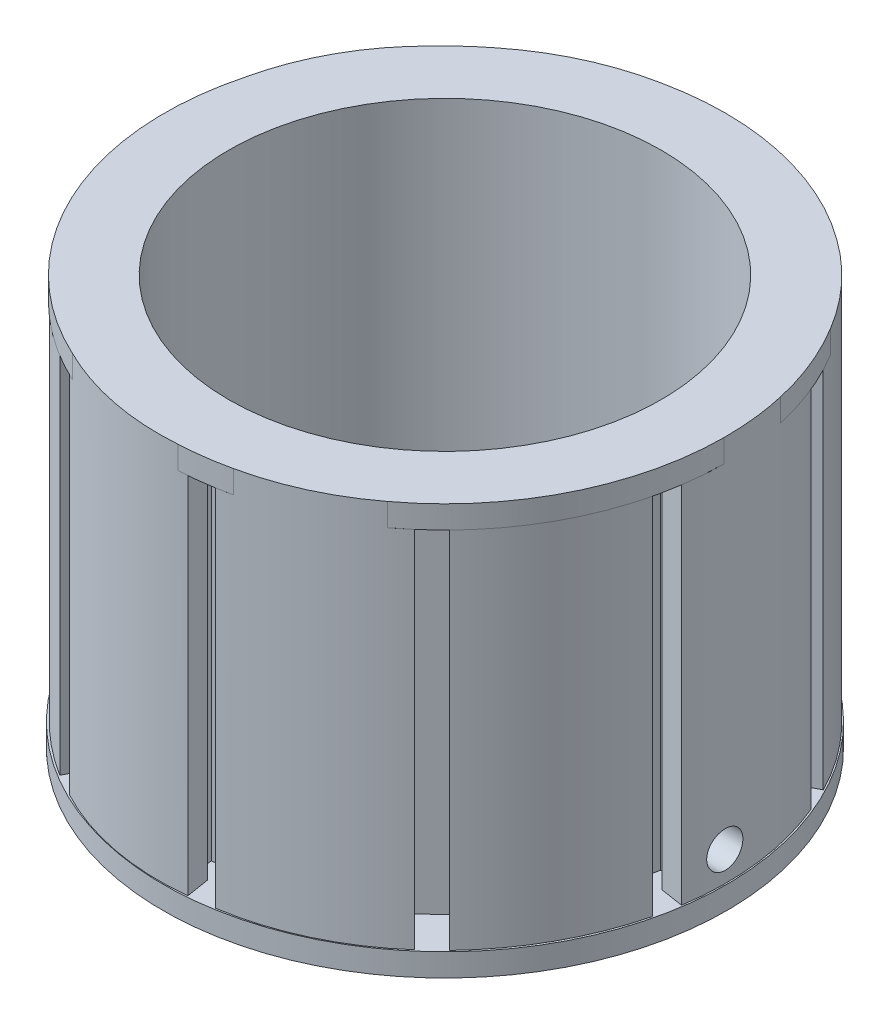
from build123d import *

# Parameters (mm, degrees)
BOSS_EXTRUDE1_DEPTH     = 36
SKETCH6_R               = 4
CUT_EXTRUDE1_DEPTH      = 51.118905329
SKETCH7_R               = 19
CUT_EXTRUDE2_DEPTH      = 28
SKETCH8_R               = 24.640257617
SKETCH8_R_2             = 19
BOSS_EXTRUDE2_DEPTH     = 2
BOSS_EXTRUDE3_START     = -2
SKETCH9_R               = 24.765471232
SKETCH9_R_2             = 19
BOSS_EXTRUDE3_DEPTH     = 2
CUT_EXTRUDE4_DEPTH      = 133.195882603
CUT_EXTRUDE4_DEPTH_BACK = 133.195882603
SKETCH12_R              = 1.585


with BuildPart() as part:
    # Sketch5 → Boss-Extrude1 (new body)
    with BuildSketch(Plane(origin=(0, 0, 0), x_dir=(1, 0, 0), z_dir=(0, 1, 0))):
        with BuildLine():
            Line((-24.362984614, 3.572359692), (-22.313286634, 3.256454852))
            Line((-22.313286634, 3.256454852), (-22.526139017, 2.16729886))
            Line((-22.526139017, 2.16729886), (-20.776467593, 1.825362779))
            Line((-20.776467593, 1.825362779), (-19.941416091, 6.131877613))
            Line((-19.941416091, 6.131877613), (-21.677029311, 6.475275507))
            Line((-21.677029311, 6.475275507), (-21.884939056, 5.40533318))
            Line((-21.884939056, 5.40533318), (-23.944192117, 5.722710675))
            ThreePointArc((-23.944192117, 5.722710675), (-21.682866171, 11.965840949), (-17.610288244, 17.210302759))
            Line((-17.610288244, 17.210302759), (-16.137731951, 15.74994813))
            Line((-16.137731951, 15.74994813), (-16.950122975, 14.993913915))
            Line((-16.950122975, 14.993913915), (-15.735594044, 13.688850755))
            Line((-15.735594044, 13.688850755), (-12.52871728, 16.682063485))
            Line((-12.52871728, 16.682063485), (-13.731013652, 17.980046071))
            Line((-13.731013652, 17.980046071), (-14.52811249, 17.236650828))
            Line((-14.52811249, 17.236650828), (-16.007533401, 18.703813195))
            ThreePointArc((-16.007533401, 18.703813195), (-10.474304885, 22.352615221), (-4.131060316, 24.274495129))
            Line((-4.131060316, 24.274495129), (-3.798112164, 22.227496544))
            Line((-3.798112164, 22.227496544), (-4.89973607, 22.093363479))
            Line((-4.89973607, 22.093363479), (-4.684258404, 20.32366301))
            Line((-4.684258404, 20.32366301), (-0.330474303, 20.860268108))
            Line((-0.330474303, 20.860268108), (-0.540217479, 22.617050155))
            Line((-0.540217479, 22.617050155), (-1.622040745, 22.484153711))
            Line((-1.622040745, 22.484153711), (-1.956541002, 24.540694793))
            ThreePointArc((-1.956541002, 24.540694793), (4.651309478, 24.170837782), (10.926092243, 22.066655419))
            Line((10.926092243, 22.066655419), (9.992257377, 20.214896763))
            Line((9.992257377, 20.214896763), (9.022183477, 20.753899119))
            Line((9.022183477, 20.753899119), (8.156304735, 19.19552677))
            Line((8.156304735, 19.19552677), (11.993998625, 17.070559328))
            Line((11.993998625, 17.070559328), (12.85692341, 18.615109805))
            Line((12.85692341, 18.615109805), (11.903595433, 19.143474085))
            Line((11.903595433, 19.143474085), (12.841783559, 21.003865088))
            ThreePointArc((12.841783559, 21.003865088), (18.005151406, 16.85334037), (21.809848929, 11.430103357))
            Line((21.809848929, 11.430103357), (19.965924224, 10.480893498))
            Line((19.965924224, 10.480893498), (19.49793559, 11.487150696))
            Line((19.49793559, 11.487150696), (17.881436687, 10.735351737))
            Line((17.881436687, 10.735351737), (19.73717174, 6.760477092))
            Line((19.73717174, 6.760477092), (21.343156548, 7.502830214))
            Line((21.343156548, 7.502830214), (20.882462745, 8.490638021))
            Line((20.882462745, 8.490638021), (22.734983277, 9.444272814))
            ThreePointArc((22.734983277, 9.444272814), (24.455073827, 3.049281996), (24.362984614, -3.572359692))
            Line((24.362984614, -3.572359692), (22.313286634, -3.256454852))
            Line((22.313286634, -3.256454852), (22.526139017, -2.16729886))
            Line((22.526139017, -2.16729886), (20.776467593, -1.825362779))
            Line((20.776467593, -1.825362779), (19.941416091, -6.131877613))
            Line((19.941416091, -6.131877613), (21.677029311, -6.475275507))
            Line((21.677029311, -6.475275507), (21.884939056, -5.40533318))
            Line((21.884939056, -5.40533318), (23.944192117, -5.722710675))
            ThreePointArc((23.944192117, -5.722710675), (21.522464999, -11.877400691), (17.610288244, -17.210302759))
            Line((17.610288244, -17.210302759), (16.137731951, -15.74994813))
            Line((16.137731951, -15.74994813), (16.950122975, -14.993913915))
            Line((16.950122975, -14.993913915), (15.735594044, -13.688850755))
            Line((15.735594044, -13.688850755), (12.52871728, -16.682063485))
            Line((12.52871728, -16.682063485), (13.731013652, -17.980046071))
            Line((13.731013652, -17.980046071), (14.52811249, -17.236650828))
            Line((14.52811249, -17.236650828), (16.007533401, -18.703813195))
            ThreePointArc((16.007533401, -18.703813195), (10.467433433, -22.337965558), (4.131060316, -24.274495129))
            Line((4.131060316, -24.274495129), (3.798112164, -22.227496544))
            Line((3.798112164, -22.227496544), (4.89973607, -22.093363479))
            Line((4.89973607, -22.093363479), (4.684258404, -20.32366301))
            Line((4.684258404, -20.32366301), (0.330474303, -20.860268108))
            Line((0.330474303, -20.860268108), (0.540217479, -22.617050155))
            Line((0.540217479, -22.617050155), (1.622040745, -22.484153711))
            Line((1.622040745, -22.484153711), (1.956541002, -24.540694793))
            ThreePointArc((1.956541002, -24.540694793), (-4.670838102, -24.272525776), (-10.926092243, -22.066655419))
            Line((-10.926092243, -22.066655419), (-9.992257377, -20.214896763))
            Line((-9.992257377, -20.214896763), (-9.022183477, -20.753899119))
            Line((-9.022183477, -20.753899119), (-8.156304735, -19.19552677))
            Line((-8.156304735, -19.19552677), (-11.993998625, -17.070559328))
            Line((-11.993998625, -17.070559328), (-12.85692341, -18.615109805))
            Line((-12.85692341, -18.615109805), (-11.903595433, -19.143474085))
            Line((-11.903595433, -19.143474085), (-12.841783559, -21.003865088))
            ThreePointArc((-12.841783559, -21.003865088), (-17.951040918, -16.802653253), (-21.809848929, -11.430103357))
            Line((-21.809848929, -11.430103357), (-19.965924224, -10.480893498))
            Line((-19.965924224, -10.480893498), (-19.49793559, -11.487150696))
            Line((-19.49793559, -11.487150696), (-17.881436687, -10.735351737))
            Line((-17.881436687, -10.735351737), (-19.73717174, -6.760477092))
            Line((-19.73717174, -6.760477092), (-21.343156548, -7.502830214))
            Line((-21.343156548, -7.502830214), (-20.882462745, -8.490638021))
            Line((-20.882462745, -8.490638021), (-22.734983277, -9.444272814))
            ThreePointArc((-22.734983277, -9.444272814), (-24.450836742, -3.04875206), (-24.362984614, 3.572359692))
        make_face()
    extrude(amount=BOSS_EXTRUDE1_DEPTH)

    # Sketch6 → Cut-Extrude1 (cut, through all)
    with BuildSketch(Plane(origin=(0, 36, 0), x_dir=(1, 0, 0), z_dir=(0, 1, 0))):
        Circle(SKETCH6_R)
    extrude(amount=-CUT_EXTRUDE1_DEPTH, mode=Mode.SUBTRACT)

    # Sketch7 → Cut-Extrude2 (cut)
    with BuildSketch(Plane(origin=(0, 36, 0), x_dir=(1, 0, 0), z_dir=(0, 1, 0))):
        Circle(SKETCH7_R)
    extrude(amount=-CUT_EXTRUDE2_DEPTH, mode=Mode.SUBTRACT)

    # Sketch8 → Boss-Extrude2 (add)
    with BuildSketch(Plane(origin=(0, 36, 0), x_dir=(1, 0, 0), z_dir=(0, 1, 0))):
        Circle(SKETCH8_R)
        Circle(SKETCH8_R_2, mode=Mode.SUBTRACT)
    extrude(amount=-BOSS_EXTRUDE2_DEPTH)

    # Sketch9 → Boss-Extrude3 (add)
    with BuildSketch(Plane.XZ.offset(BOSS_EXTRUDE3_START)):
        Circle(SKETCH9_R)
        Circle(SKETCH9_R_2, mode=Mode.SUBTRACT)
    extrude(amount=BOSS_EXTRUDE3_DEPTH)

    # Sketch12 → Cut-Extrude4 (cut, two sides: drawn at the far end of the back side and taken through both)
    with BuildSketch(Plane(origin=(100, 0, 0), x_dir=(0, 0, -1), z_dir=(1, 0, 0)).offset(-CUT_EXTRUDE4_DEPTH_BACK)):
        with Locations((0, 4.59852315)):
            Circle(SKETCH12_R)
    extrude(amount=CUT_EXTRUDE4_DEPTH + CUT_EXTRUDE4_DEPTH_BACK, mode=Mode.SUBTRACT)


solid = part.part
